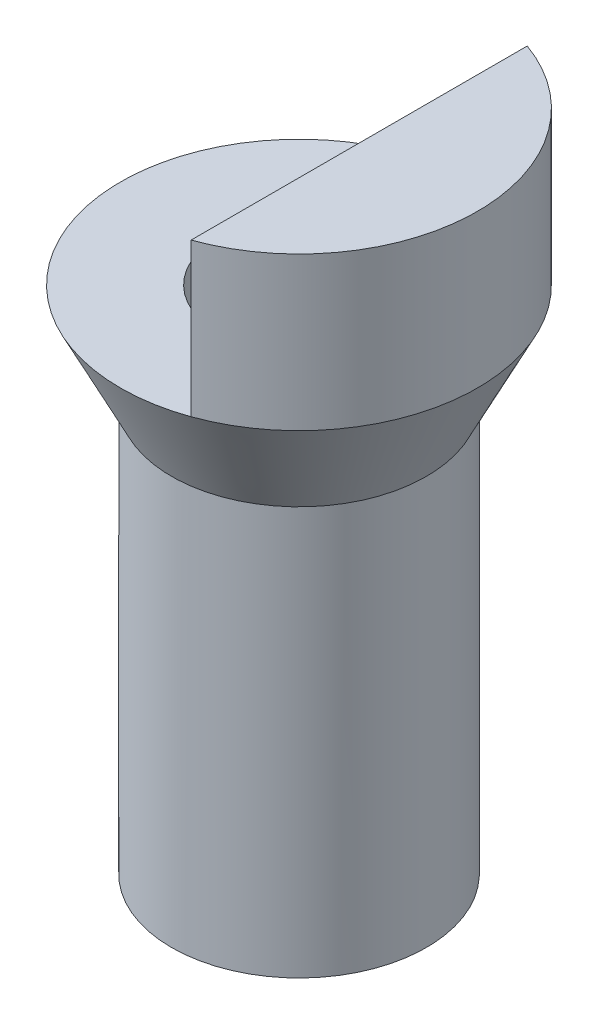
from build123d import *

# Parameters (mm, degrees)
SKETCH2_R           = 6.25
SKETCH2_R_2         = 4
BOSS_EXTRUDE1_DEPTH = 25
BOSS_EXTRUDE2_DEPTH = 7.5


# Read off the part's stored shape, not the designer's step: Surface-Imported1
with BuildPart() as part:
    # Sketch2 → Boss-Extrude1 (new body)
    with BuildSketch(Plane.XZ.offset(28.000000864)):
        with Locations(Location((33.049998865, 28.000002976, 0), (0, 0, 270))):
            Circle(SKETCH2_R)
        with Locations(Location((33.049998865, 28.000002976, 0), (0, 0, 270))):
            Circle(SKETCH2_R_2, mode=Mode.SUBTRACT)
    extrude(amount=BOSS_EXTRUDE1_DEPTH)

    # Sketch7 → Revolve1 (revolve)
    with BuildSketch(Plane.XY.offset(28.000002976), mode=Mode.PRIVATE) as revolve1_sk:
        Polygon((26.799998865, -33.000000864), (24.299998865, -28.000000864), (26.799998865, -28.000000864), align=None)
    revolve(revolve1_sk.sketch.rotate(Axis((33.049998865, -53.000000864, 28.000002976), (0, 1, 0)), 270), axis=Axis((33.049998865, -53.000000864, 28.000002976), (0, 1, 0)))

    # Sketch4 → Boss-Extrude2 (add)
    with BuildSketch(Plane(origin=(0, -28.000000864, 0), x_dir=(1, 0, 0), z_dir=(0, 1, 0))):
        with BuildLine():
            Line((35.99999845, -19.762284697), (35.99999845, -36.237721255))
            ThreePointArc((35.99999845, -36.237721255), (41.799998865, -28.000002976), (35.99999845, -19.762284697))
        make_face()
    extrude(amount=BOSS_EXTRUDE2_DEPTH)


solid = part.part
